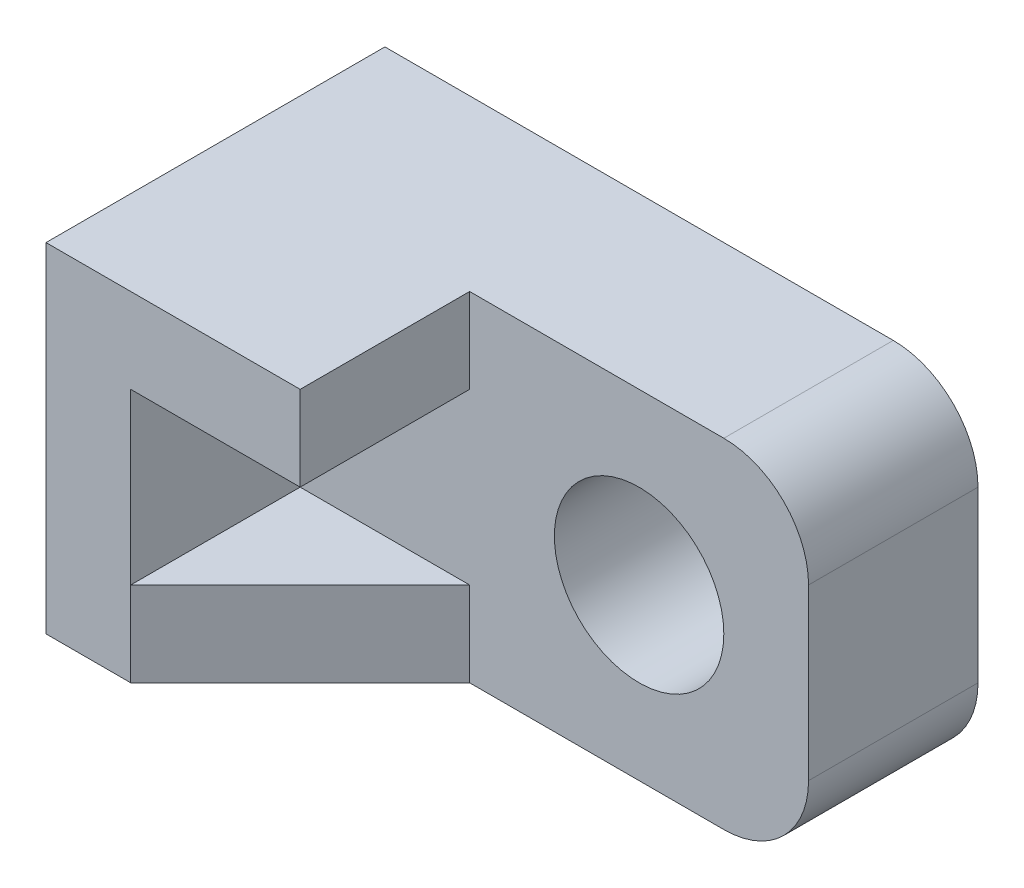
from build123d import *

# Parameters (mm, degrees)
BOSS_EXTRUDE1_DEPTH = 1016
SKETCH1_4_W         = 508
SKETCH1_4_H         = 254
BOSS_EXTRUDE2_DEPTH = 1016
SKETCH1_5_R         = 254
BOSS_EXTRUDE3_DEPTH = 508
CUT_EXTRUDE4_START  = -254
CUT_EXTRUDE4_DEPTH  = 254


# Read off the part's stored shape, not the designer's step: Cut-Extrude4
with BuildPart() as part:
    # Sketch1 → Boss-Extrude1 (new body)
    with BuildSketch(Plane.XY):
        Polygon((762, 0), (0, 0), (0, -1016), (254, -1016), (254, -762), (254, -254), (762, -254), align=None)
    extrude(amount=BOSS_EXTRUDE1_DEPTH)

    # Sketch1<4> → Boss-Extrude2 (add)
    with BuildSketch(Plane.XY):
        with Locations((508, -889)):
            Rectangle(SKETCH1_4_W, SKETCH1_4_H)
    extrude(amount=BOSS_EXTRUDE2_DEPTH)

    # Sketch1<5> → Boss-Extrude3 (add)
    with BuildSketch(Plane.XY):
        with BuildLine():
            Line((1524, 0), (762, 0))
            Line((762, 0), (762, -254))
            Line((762, -254), (254, -254))
            Line((254, -254), (254, -762))
            Line((254, -762), (762, -762))
            Line((762, -762), (762, -1016))
            Line((762, -1016), (1524, -1016))
            ThreePointArc((1524, -1016), (1703.605122421, -941.605122421), (1778, -762))
            Line((1778, -762), (1778, -254))
            ThreePointArc((1778, -254), (1703.605122421, -74.394877579), (1524, 0))
        make_face()
        with Locations((1270, -508)):
            Circle(SKETCH1_5_R, mode=Mode.SUBTRACT)
    extrude(amount=BOSS_EXTRUDE3_DEPTH)

    # Cut-Extrude4 outline → Cut-Extrude4 (cut)
    with BuildSketch(Plane(origin=(0, -762, 0), x_dir=(1, 0, 0), z_dir=(0, 1, 0)).offset(CUT_EXTRUDE4_START)):
        Polygon((762, -1016), (762, -508), (254, -1016), align=None)
    extrude(amount=CUT_EXTRUDE4_DEPTH, mode=Mode.SUBTRACT)


solid = part.part
